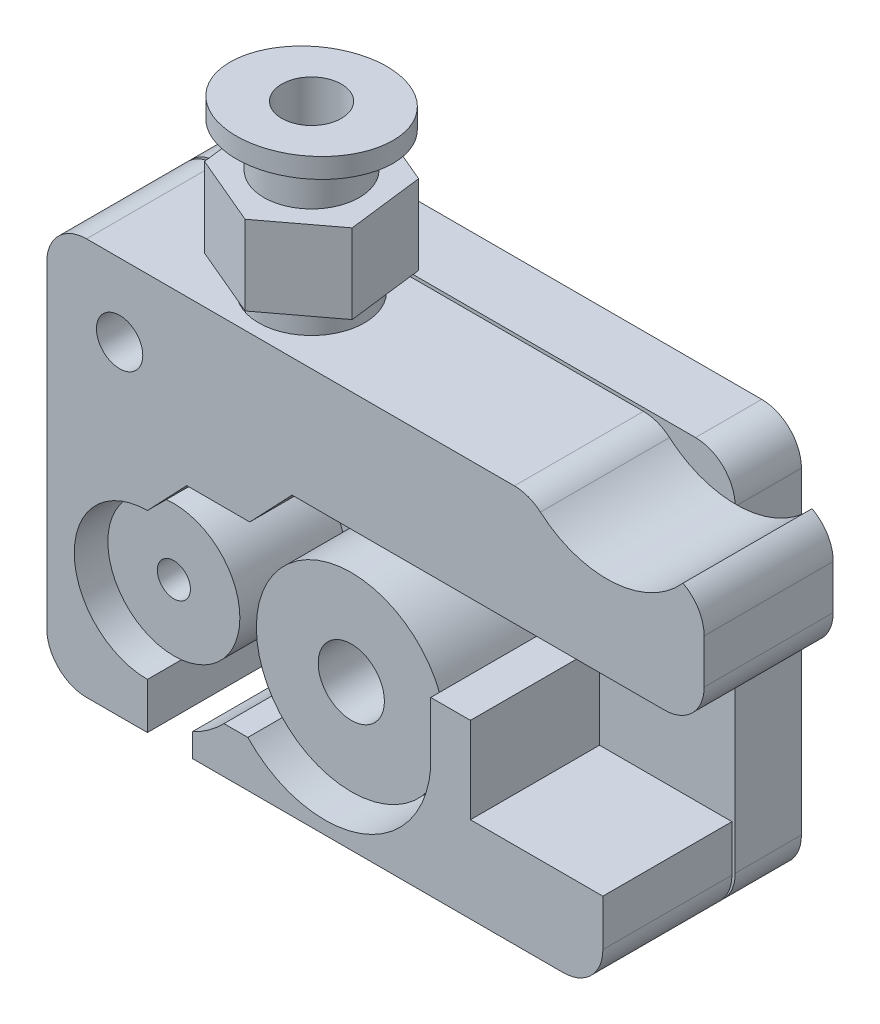
from build123d import *

# Parameters (mm, degrees)
SKETCH1_W           = 42
SKETCH1_H           = 30
BOSS_EXTRUDE1_DEPTH = 5
BOSS_EXTRUDE2_START = 0.25
BOSS_EXTRUDE2_DEPTH = 9.75
FILLET1_R           = 3
SKETCH6_R           = 4
SKETCH6_R_2         = 2.25
BOSS_EXTRUDE3_DEPTH = 2
FILLET2_R           = 3
FILLET3_R           = 3
FILLET4_R           = 3
BOSS_EXTRUDE5_DEPTH = 6
SKETCH14_R          = 3.605025609
BOSS_EXTRUDE6_DEPTH = 2
SKETCH15_R          = 2.592744477
BOSS_EXTRUDE7_DEPTH = 1
SKETCH16_RX         = 5.75
SKETCH16_RY         = 5
BOSS_EXTRUDE8_DEPTH = 1.5
SKETCH8_R           = 1.75
CUT_EXTRUDE10_DEPTH = 5
SKETCH5_R           = 8.15
CUT_EXTRUDE2_DEPTH  = 10
SKETCH10_R          = 11
CUT_EXTRUDE11_DEPTH = 2
SKETCH19_R          = 2.25
CUT_EXTRUDE14_DEPTH = 11
SKETCH17_R          = 1.75
CUT_EXTRUDE12_DEPTH = 43.451073105
SKETCH9_R           = 4.985129207
SKETCH9_R_2         = 7.17163429
BOSS_EXTRUDE9_DEPTH = 8
SKETCH21_R          = 2.5
SKETCH21_R_2        = 1.25
CUT_EXTRUDE17_DEPTH = 8
SKETCH20_R          = 1.25
CUT_EXTRUDE16_DEPTH = 30


with BuildPart() as part:
    # Sketch1 → Boss-Extrude1 (new body)
    with BuildSketch(Plane.XY):
        Rectangle(SKETCH1_W, SKETCH1_H)
    extrude(amount=BOSS_EXTRUDE1_DEPTH)

    # Fillet1
    fillet1_edges = [part.edges().sort_by_distance(p)[0] for p in [
        (21, -15, 2.5),
        (-21, -15, 2.5),
        (-21, 15, 2.5),
        (21, 15, 2.5),
    ]]
    fillet(fillet1_edges, radius=FILLET1_R)

    # Sketch8 → Cut-Extrude10 (cut)
    with BuildSketch(Plane.XY):
        with Locations((15.5, 9.5)):
            Circle(SKETCH8_R)
        with Locations((-15.5, 9.5)):
            Circle(SKETCH8_R)
    extrude(amount=CUT_EXTRUDE10_DEPTH, mode=Mode.SUBTRACT)

    # Sketch5 → Cut-Extrude2 (cut)
    with BuildSketch(Plane.XY.offset(5)):
        with Locations((0, -6)):
            Circle(SKETCH5_R)
    extrude(amount=-CUT_EXTRUDE2_DEPTH, mode=Mode.SUBTRACT)

    # Sketch10 → Cut-Extrude11 (cut)
    with BuildSketch(Plane(origin=(0, 0, 0), x_dir=(-1, 0, 0), z_dir=(0, 0, -1))):
        with Locations((0, -6)):
            Circle(SKETCH10_R)
    extrude(amount=-CUT_EXTRUDE11_DEPTH, mode=Mode.SUBTRACT)

    # Sketch9 → Boss-Extrude9 (add)
    with BuildSketch(Plane.XY.offset(5)):
        with Locations(Location((-13.402224813, -6, 0), (0, 0, 180))):
            Circle(SKETCH9_R)
        with Locations((0, -6)):
            Circle(SKETCH9_R_2)
    extrude(amount=BOSS_EXTRUDE9_DEPTH)


with BuildPart() as body_2:
    # Sketch2 → Boss-Extrude2 (new body)
    with BuildSketch(Plane.XY.offset(5).offset(BOSS_EXTRUDE2_START)):
        with BuildLine():
            Line((-2.472815877, 6), (21, 6))
            Line((21, 6), (21, 12.403357084))
            ThreePointArc((21, 12.403357084), (18.007538755, 13.141577193), (15.548665456, 15))
            Line((15.548665456, 15), (-21, 15))
            Line((-21, 15), (-21, -15))
            Line((-21, -15), (-13.402224813, -15))
            Line((-13.402224813, -15), (-13.402224813, -11.523181725))
            ThreePointArc((-13.402224813, -11.523181725), (-18.925406538, -6), (-13.402224813, -0.476818275))
            Line((-13.402224813, -0.476818275), (-10.433447695, 2.64166607))
            Line((-10.433447695, 2.64166607), (-5.669928262, 2.64166607))
            Line((-5.669928262, 2.64166607), (-2.472815877, 6))
        make_face()
        with BuildLine():
            Line((8, -2), (8, -6.57))
            ThreePointArc((8, -6.57), (2.706764841, -13.549723445), (-5.815441826, -11.523181725))
            Line((-5.815441826, -11.523181725), (-7.618792835, -11.523181725))
            ThreePointArc((-7.618792835, -11.523181725), (-8.730113763, -12.490377504), (-10, -13.2372984))
            Line((-10, -13.2372984), (-10, -15))
            Line((-10, -15), (21, -15))
            Line((21, -15), (21, -8.5))
            Line((21, -8.5), (11, -8.5))
            Line((11, -8.5), (11, -2))
            Line((11, -2), (8, -2))
        make_face()
        with BuildLine():
            Line((21, 12.403357084), (21, 6))
            Line((21, 6), (28.65036837, 6))
            Line((28.65036837, 6), (28.65036837, 15))
            Line((28.65036837, 15), (27.051334544, 15))
            ThreePointArc((27.051334544, 15), (24.31908938, 13.017874339), (21, 12.403357084))
        make_face()
    extrude(amount=BOSS_EXTRUDE2_DEPTH)

    # Fillet2
    fillet2_edges = [body_2.edges().sort_by_distance(p)[0] for p in [
        (-21, 15, 10.125),
    ]]
    fillet(fillet2_edges, radius=FILLET2_R)

    # Fillet3
    fillet3_edges = [body_2.edges().sort_by_distance(p)[0] for p in [
        (21, -15, 10.125),
    ]]
    fillet(fillet3_edges, radius=FILLET3_R)

    # Fillet4
    # the kernel refuses this fillet: 3 mm, written as the material it takes off along each edge
    with BuildSketch(Plane(origin=(28.65036837, 15, -1.381974526), x_dir=(-1, 0, 0), z_dir=(0, 0, 1))) as fillet4_piece_1:
        with BuildLine():
            CenterArc((3, 2.65278981), FILLET4_R, 180, 62.160994983)
            Line((0, 2.65278981), (-0.06, 2.65278981))
            Line((-0.06, 2.65278981), (-0.06, 0))
            Line((-0.06, 0), (0, -0.06))
            ThreePointArc((0, -0.06), (0.799516913, -0.06), (1.571014502, -0.053055796))
            Line((1.571014502, -0.053055796), (1.599033825, 0))
        make_face()
    extrude(amount=23.013949052, mode=Mode.SUBTRACT)
    with BuildSketch(Plane(origin=(28.65036837, 6, -2.25), x_dir=(0, 1, 0), z_dir=(0, 0, 1))) as fillet4_piece_2:
        with BuildLine():
            CenterArc((FILLET4_R, FILLET4_R), FILLET4_R, 180, 90)
            Line((0, FILLET4_R), (-FILLET4_R * 0.02, FILLET4_R))
            Line((-FILLET4_R * 0.02, FILLET4_R), (-FILLET4_R * 0.02, -FILLET4_R * 0.02))
            Line((-FILLET4_R * 0.02, -FILLET4_R * 0.02), (FILLET4_R, -FILLET4_R * 0.02))
            Line((FILLET4_R, -FILLET4_R * 0.02), (FILLET4_R, 0))
        make_face()
    extrude(amount=24.75, mode=Mode.SUBTRACT)
    with BuildSketch(Plane(origin=(-21, -15, -2.25), x_dir=(0, 1, 0), z_dir=(0, 0, 1))) as fillet4_piece_3:
        with BuildLine():
            CenterArc((FILLET4_R, -FILLET4_R), FILLET4_R, 90, 90)
            Line((0, -FILLET4_R), (-FILLET4_R * 0.02, -FILLET4_R))
            Line((-FILLET4_R * 0.02, -FILLET4_R), (-FILLET4_R * 0.02, FILLET4_R * 0.02))
            Line((-FILLET4_R * 0.02, FILLET4_R * 0.02), (FILLET4_R, FILLET4_R * 0.02))
            Line((FILLET4_R, FILLET4_R * 0.02), (FILLET4_R, 0))
        make_face()
    extrude(amount=24.75, mode=Mode.SUBTRACT)
    with BuildSketch(Plane(origin=(15.548665456, 15, 2.183246521), x_dir=(-1, 0, 0), z_dir=(0, 0, 1))) as fillet4_piece_4:
        with BuildLine():
            CenterArc((1.226701392, 3), FILLET4_R, 229.093072907, 40.906927093)
            Line((-0.737795184, 0.732677085), (-0.777085116, 0.687330626))
            ThreePointArc((-0.777085116, 0.687330626), (-0.398723642, 0.336304143), (-0.045071859, -0.03960464))
            Line((-0.045071859, -0.03960464), (0, -0.06))
            Line((0, -0.06), (1.226701392, -0.06))
            Line((1.226701392, -0.06), (1.226701392, 0))
        make_face()
    extrude(amount=15.883506959, mode=Mode.SUBTRACT)

    # Sketch17 → Cut-Extrude12 (cut, through all)
    with BuildSketch(Plane.XY.offset(15)):
        with Locations((-15.5, 9.5)):
            Circle(SKETCH17_R)
    extrude(amount=-CUT_EXTRUDE12_DEPTH, mode=Mode.SUBTRACT)

    # Sketch20 → Cut-Extrude16 (cut)
    with BuildSketch(Plane(origin=(0, 15, 0), x_dir=(1, 0, 0), z_dir=(0, 1, 0))):
        with Locations(Location((-6, -10, 0), (0, 0, 270))):
            Circle(SKETCH20_R)
    extrude(amount=-CUT_EXTRUDE16_DEPTH, mode=Mode.SUBTRACT)


with BuildPart() as body_3:
    # Sketch6 → Boss-Extrude3 (new body)
    with BuildSketch(Plane(origin=(0, 15, 0), x_dir=(1, 0, 0), z_dir=(0, 1, 0))):
        with Locations(Location((-6, -10, 0), (0, 0, 270))):
            Circle(SKETCH6_R)
        with Locations(Location((-6, -10, 0), (0, 0, 270))):
            Circle(SKETCH6_R_2, mode=Mode.SUBTRACT)
    extrude(amount=BOSS_EXTRUDE3_DEPTH)

    # Sketch13 → Boss-Extrude5 (add)
    with BuildSketch(Plane(origin=(0, 17, 0), x_dir=(1, 0, 0), z_dir=(0, 1, 0))):
        Polygon((-0.683347986, -12.250898641), (-1.392338588, -6.521093613), (-6.708990602, -4.270194972), (-11.316652014, -7.749101359), (-10.607661412, -13.478906387), (-5.291009398, -15.729805028), align=None)
    extrude(amount=BOSS_EXTRUDE5_DEPTH)

    # Sketch14 → Boss-Extrude6 (add)
    with BuildSketch(Plane(origin=(0, 23, 0), x_dir=(1, 0, 0), z_dir=(0, 1, 0))):
        with Locations(Location((-6, -10, 0), (0, 0, 270))):
            Circle(SKETCH14_R)
    extrude(amount=BOSS_EXTRUDE6_DEPTH)

    # Sketch15 → Boss-Extrude7 (add)
    with BuildSketch(Plane(origin=(0, 25, 0), x_dir=(1, 0, 0), z_dir=(0, 1, 0))):
        with Locations(Location((-6, -10, 0), (0, 0, 270))):
            Circle(SKETCH15_R)
    extrude(amount=BOSS_EXTRUDE7_DEPTH)

    # Sketch16 → Boss-Extrude8 (add)
    with BuildSketch(Plane(origin=(0, 26, 0), x_dir=(1, 0, 0), z_dir=(0, 1, 0))):
        with Locations(Location((-6, -10), (0, 0, -157.110370681))):
            Ellipse(SKETCH16_RX, SKETCH16_RY)
    extrude(amount=BOSS_EXTRUDE8_DEPTH)

    # Sketch19 → Cut-Extrude14 (cut)
    with BuildSketch(Plane(origin=(0, 27.5, 0), x_dir=(1, 0, 0), z_dir=(0, 1, 0))):
        with Locations(Location((-6, -10, 0), (0, 0, 270))):
            Circle(SKETCH19_R)
    extrude(amount=-CUT_EXTRUDE14_DEPTH, mode=Mode.SUBTRACT)


with BuildPart() as boss_extrude9_piece_1:
    # of the separate pieces the step leaves, piece 1, a body of its own (boss_extrude9_pieces)
    add(part.part.solids().sort_by_distance((-18, -15, 0))[0])


with BuildPart() as boss_extrude9_piece_2:
    # of the separate pieces the step leaves, piece 2, a body of its own (boss_extrude9_pieces)
    add(part.part.solids().sort_by_distance((7.17163429, -6, 5))[0])


with BuildPart() as cut_extrude17_tool:
    # Sketch21 → Cut-Extrude17 (new body)
    with BuildSketch(Plane.XY.offset(13)):
        with Locations((0, -6)):
            Circle(SKETCH21_R)
        with Locations((-13.402224813, -6)):
            Circle(SKETCH21_R_2)
    extrude(amount=-CUT_EXTRUDE17_DEPTH)


with BuildPart() as boss_extrude9_piece_1_1:
    add(boss_extrude9_piece_1.part)

    # Cut-Extrude17: cut by cut_extrude17_tool
    add(cut_extrude17_tool.part, mode=Mode.SUBTRACT)


with BuildPart() as boss_extrude9_piece_2_1:
    add(boss_extrude9_piece_2.part)

    # Cut-Extrude17: cut by cut_extrude17_tool
    add(cut_extrude17_tool.part, mode=Mode.SUBTRACT)


solid = Compound([body_2.part, body_3.part, boss_extrude9_piece_1_1.part, boss_extrude9_piece_2_1.part])
